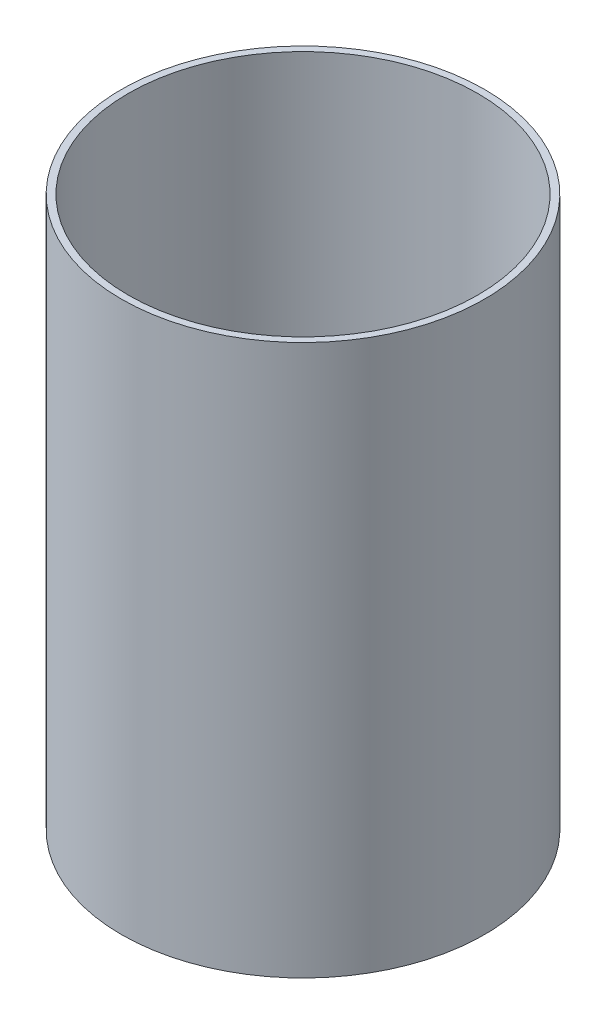
from build123d import *

# Parameters (mm, degrees)
SKETCH1_R           = 39.6
SKETCH1_R_2         = 38.1
BOSS_EXTRUDE1_DEPTH = 120


with BuildPart() as part:
    # Sketch1 → Boss-Extrude1 (new body)
    with BuildSketch(Plane(origin=(0, 0, 0), x_dir=(1, 0, 0), z_dir=(0, 1, 0))):
        Circle(SKETCH1_R)
        Circle(SKETCH1_R_2, mode=Mode.SUBTRACT)
    extrude(amount=BOSS_EXTRUDE1_DEPTH)


solid = part.part
